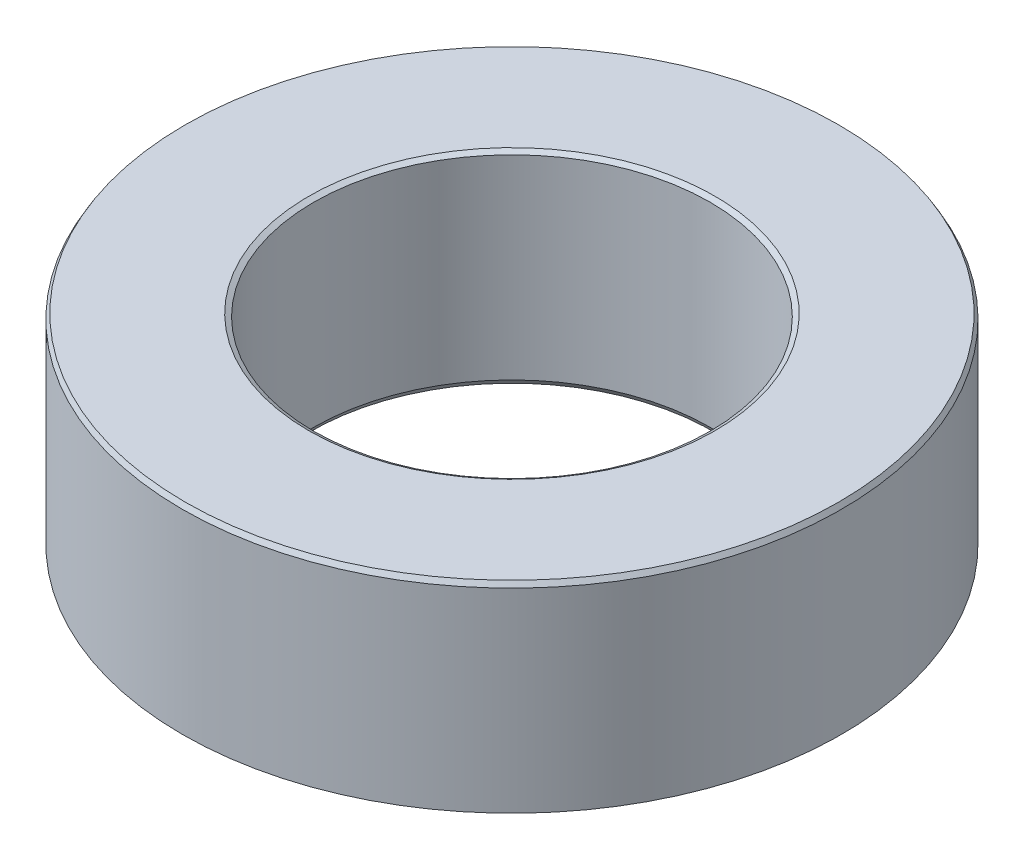
from build123d import *
from OCP.BRepFilletAPI import BRepFilletAPI_MakeChamfer

# Parameters (mm, degrees)
SKETCH1_R           = 25
BOSS_EXTRUDE1_DEPTH = 15.368823297
SKETCH2_R           = 15.041085336
CUT_EXTRUDE1_DEPTH  = 39.551274032
CHAMFER1_SIZE       = 0.367669686
CHAMFER1_SIZE2      = 0.212274192


with BuildPart() as part:
    # Sketch1 → Boss-Extrude1 (new body)
    with BuildSketch(Plane(origin=(0, 0, 0), x_dir=(1, 0, 0), z_dir=(0, 1, 0))):
        Circle(SKETCH1_R)
    extrude(amount=BOSS_EXTRUDE1_DEPTH)

    # Sketch2 → Cut-Extrude1 (cut, through all)
    with BuildSketch(Plane(origin=(0, 0, 0), x_dir=(1, 0, 0), z_dir=(0, 1, 0))):
        Circle(SKETCH2_R)
    extrude(amount=CUT_EXTRUDE1_DEPTH, mode=Mode.SUBTRACT)

    # Chamfer1: one chamfer whose edges measure the first distance from different faces: ONE call of the kernel's chamfer builder (chamfer() names one face for all edges)
    chamfer1_edges_1 = [part.edges().sort_by_distance(p)[0] for p in [
        (-15.041085336, 15.368823297, 0),
    ]]
    chamfer1_side_1 = [part.faces().sort_by_distance(p)[0] for p in [
        (-24.292893219, 15.368823297, 0),
    ]]
    chamfer1_edges_2 = [part.edges().sort_by_distance(p)[0] for p in [
        (-15.041085336, 0, 0),
    ]]
    chamfer1_side_2 = [part.faces().sort_by_distance(p)[0] for p in [
        (-15.041085336, 7.684411648, 0),
    ]]
    chamfer1_edges_3 = [part.edges().sort_by_distance(p)[0] for p in [
        (-25, 0, 0),
    ]]
    chamfer1_side_3 = [part.faces().sort_by_distance(p)[0] for p in [
        (-24.292893219, 0, 0),
    ]]
    chamfer1_edges_4 = [part.edges().sort_by_distance(p)[0] for p in [
        (-25, 15.368823297, 0),
    ]]
    chamfer1_side_4 = [part.faces().sort_by_distance(p)[0] for p in [
        (-25, 7.684411648, 0),
    ]]
    chamfer1 = BRepFilletAPI_MakeChamfer(part.part.solid().wrapped)
    for e in chamfer1_edges_1:
        chamfer1.Add(CHAMFER1_SIZE, CHAMFER1_SIZE2, e.wrapped, chamfer1_side_1[0].wrapped)  # the first distance lies on this face
    for e in chamfer1_edges_2:
        chamfer1.Add(CHAMFER1_SIZE, CHAMFER1_SIZE2, e.wrapped, chamfer1_side_2[0].wrapped)  # the first distance lies on this face
    for e in chamfer1_edges_3:
        chamfer1.Add(CHAMFER1_SIZE, CHAMFER1_SIZE2, e.wrapped, chamfer1_side_3[0].wrapped)  # the first distance lies on this face
    for e in chamfer1_edges_4:
        chamfer1.Add(CHAMFER1_SIZE, CHAMFER1_SIZE2, e.wrapped, chamfer1_side_4[0].wrapped)  # the first distance lies on this face
    add(Compound.cast(chamfer1.Shape()), mode=Mode.REPLACE)


solid = part.part
